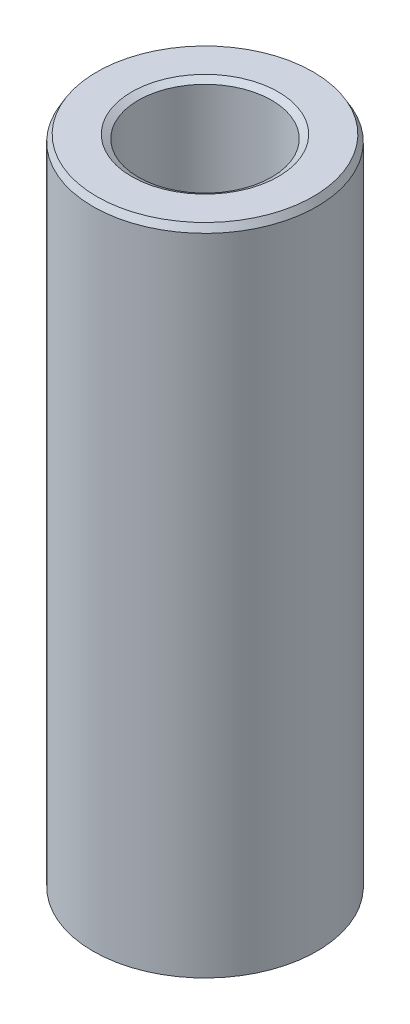
from build123d import *
from OCP.BRepFilletAPI import BRepFilletAPI_MakeChamfer

# Parameters (mm, degrees)
SKETCH1_R           = 40
BOSS_EXTRUDE1_DEPTH = 234.147937617
SKETCH2_R           = 23.819666882
CUT_EXTRUDE1_DEPTH  = 241.884322218
CHAMFER1_SIZE       = 2.391690607
CHAMFER1_SIZE2      = 1.380843216


with BuildPart() as part:
    # Sketch1 → Boss-Extrude1 (new body)
    with BuildSketch(Plane(origin=(0, 0, 0), x_dir=(1, 0, 0), z_dir=(0, 1, 0))):
        Circle(SKETCH1_R)
    extrude(amount=BOSS_EXTRUDE1_DEPTH)

    # Sketch2 → Cut-Extrude1 (cut, through all)
    with BuildSketch(Plane(origin=(0, 0, 0), x_dir=(1, 0, 0), z_dir=(0, 1, 0))):
        Circle(SKETCH2_R)
    extrude(amount=CUT_EXTRUDE1_DEPTH, mode=Mode.SUBTRACT)

    # Chamfer1: one chamfer whose edges measure the first distance from different faces: ONE call of the kernel's chamfer builder (chamfer() names one face for all edges)
    chamfer1_edges_1 = [part.edges().sort_by_distance(p)[0] for p in [
        (-23.819666882, 234.147937617, 0),
    ]]
    chamfer1_side_1 = [part.faces().sort_by_distance(p)[0] for p in [
        (-38.86862915, 234.147937617, 0),
    ]]
    chamfer1_edges_2 = [part.edges().sort_by_distance(p)[0] for p in [
        (-23.819666882, 0, 0),
    ]]
    chamfer1_side_2 = [part.faces().sort_by_distance(p)[0] for p in [
        (-23.819666882, 117.073968809, 0),
    ]]
    chamfer1_edges_3 = [part.edges().sort_by_distance(p)[0] for p in [
        (-40, 0, 0),
    ]]
    chamfer1_side_3 = [part.faces().sort_by_distance(p)[0] for p in [
        (-38.86862915, 0, 0),
    ]]
    chamfer1_edges_4 = [part.edges().sort_by_distance(p)[0] for p in [
        (-40, 234.147937617, 0),
    ]]
    chamfer1_side_4 = [part.faces().sort_by_distance(p)[0] for p in [
        (-40, 117.073968809, 0),
    ]]
    chamfer1 = BRepFilletAPI_MakeChamfer(part.part.solid().wrapped)
    for e in chamfer1_edges_1:
        chamfer1.Add(CHAMFER1_SIZE, CHAMFER1_SIZE2, e.wrapped, chamfer1_side_1[0].wrapped)  # the first distance lies on this face
    for e in chamfer1_edges_2:
        chamfer1.Add(CHAMFER1_SIZE, CHAMFER1_SIZE2, e.wrapped, chamfer1_side_2[0].wrapped)  # the first distance lies on this face
    for e in chamfer1_edges_3:
        chamfer1.Add(CHAMFER1_SIZE, CHAMFER1_SIZE2, e.wrapped, chamfer1_side_3[0].wrapped)  # the first distance lies on this face
    for e in chamfer1_edges_4:
        chamfer1.Add(CHAMFER1_SIZE, CHAMFER1_SIZE2, e.wrapped, chamfer1_side_4[0].wrapped)  # the first distance lies on this face
    add(Compound.cast(chamfer1.Shape()), mode=Mode.REPLACE)


solid = part.part
